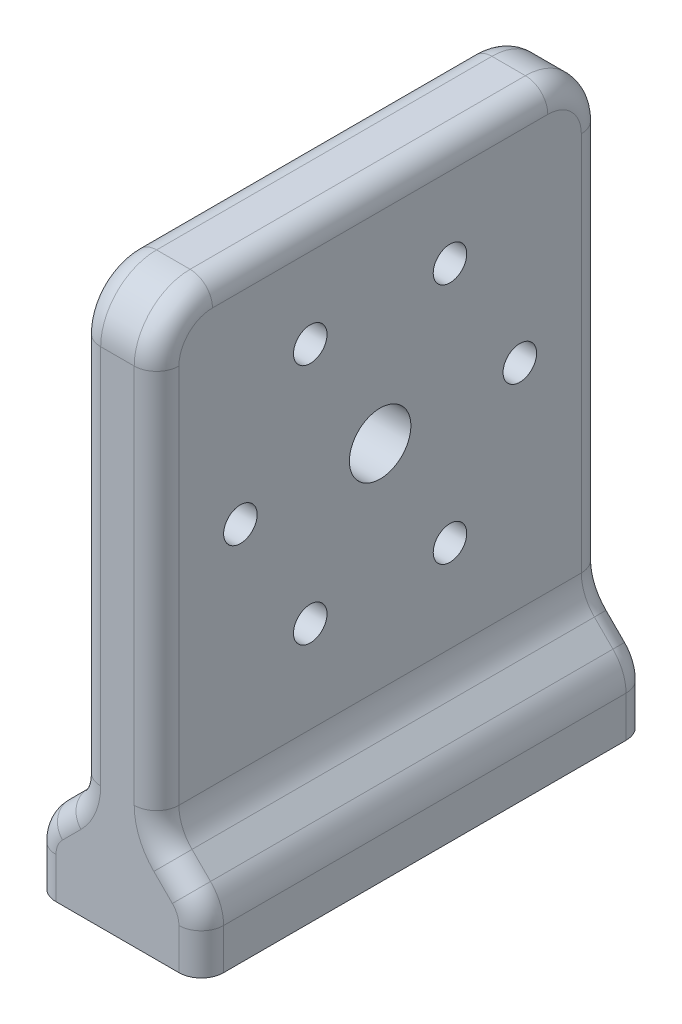
from build123d import *

# Parameters (mm, degrees)
SKETCH1_W                = 7
SKETCH1_H                = 40
BOSS_EXTRUDE1_DEPTH      = 50
BOSS_EXTRUDE2_DEPTH      = 4
BOSS_EXTRUDE2_DEPTH_BACK = 11
SKETCH3_W                = 40
SKETCH3_H                = 12.312299815
CHAMFER1_SIZE            = 7
FILLET1_R                = 4
SKETCH4_R                = 2
CUT_EXTRUDE2_DEPTH       = 10
SKETCH5_R                = 1.5
SKETCH5_R_2              = 2.75
CUT_EXTRUDE3_DEPTH       = 55.963624335
FILLET2_R                = 5
FILLET3_R                = 2


with BuildPart() as part:
    # Sketch1 → Boss-Extrude1 (new body)
    with BuildSketch(Plane(origin=(0, 0, 0), x_dir=(1, 0, 0), z_dir=(0, 1, 0))):
        Rectangle(SKETCH1_W, SKETCH1_H)
    extrude(amount=BOSS_EXTRUDE1_DEPTH)

    # Sketch3 → Boss-Extrude2 (add, two sides: drawn at the far end of the back side and taken through both)
    with BuildSketch(Plane(origin=(3.5, 0, 0), x_dir=(0, 0, -1), z_dir=(1, 0, 0)).offset(-BOSS_EXTRUDE2_DEPTH_BACK)):
        with Locations((0, 6.156149908)):
            Rectangle(SKETCH3_W, SKETCH3_H)
    extrude(amount=BOSS_EXTRUDE2_DEPTH + BOSS_EXTRUDE2_DEPTH_BACK)

    # Chamfer1
    # the kernel refuses this chamfer: 7 mm, written as the material it takes off along each edge
    with BuildSketch(Plane(origin=(-7.5, 12.312299815, 38.001780916), x_dir=(0.9996219169112968, 0.027495876610586365, 0), z_dir=(0, 0, -1))) as chamfer1_piece_1_section:
        Polygon((CHAMFER1_SIZE * 0.999621916911, CHAMFER1_SIZE * 0.0274958766106), (-CHAMFER1_SIZE * 0.0274958766106, CHAMFER1_SIZE * 0.999621916911), (0, 0), align=None)
    chamfer1_piece_1 = extrude(amount=76.003561832, mode=Mode.PRIVATE)
    chamfer1_piece_1 = split(chamfer1_piece_1, bisect_by=Plane(origin=(-3.5, 9.652025222, 0), z_dir=(-1, 0, 0)), keep=Keep.TOP, mode=Mode.PRIVATE)
    add(chamfer1_piece_1, mode=Mode.SUBTRACT)
    with BuildSketch(Plane(origin=(7.5, 12.312299815, 38.001780916), x_dir=(0.027495876610586365, -0.9996219169112968, 0), z_dir=(0, 0, -1))) as chamfer1_piece_2_section:
        Polygon((CHAMFER1_SIZE * 0.999621916911, CHAMFER1_SIZE * 0.0274958766106), (-CHAMFER1_SIZE * 0.0274958766106, CHAMFER1_SIZE * 0.999621916911), (0, 0), align=None)
    chamfer1_piece_2 = extrude(amount=76.003561832, mode=Mode.PRIVATE)
    chamfer1_piece_2 = split(chamfer1_piece_2, bisect_by=Plane(origin=(3.5, 9.652025222, 0), z_dir=(1, 0, 0)), keep=Keep.TOP, mode=Mode.PRIVATE)
    add(chamfer1_piece_2, mode=Mode.SUBTRACT)

    # Fillet1
    fillet1_edges = [part.edges().sort_by_distance(p)[0] for p in [
        (-7.5, 5.312299815, 0),
        (7.5, 5.312299815, 0),
        (-3.5, 9.312299815, 0),
        (3.5, 9.312299815, 0),
    ]]
    fillet(fillet1_edges, radius=FILLET1_R)

    # Sketch4 → Cut-Extrude2 (cut)
    with BuildSketch(Plane.XZ):
        with Locations(Location((0, 10, 0), (0, 0, 270))):
            Circle(SKETCH4_R)
        with Locations(Location((0, -10, 0), (0, 0, 90))):
            Circle(SKETCH4_R)
    extrude(amount=-CUT_EXTRUDE2_DEPTH, mode=Mode.SUBTRACT)

    # Sketch5 → Cut-Extrude3 (cut, through all)
    with BuildSketch(Plane.ZY.offset(3.5)):
        with Locations((-12.5, 30)):
            Circle(SKETCH5_R)
        with Locations((-6.25, 40.825317547)):
            Circle(SKETCH5_R)
        with Locations((6.25, 40.825317547)):
            Circle(SKETCH5_R)
        with Locations((12.5, 30)):
            Circle(SKETCH5_R)
        with Locations((6.25, 19.174682453)):
            Circle(SKETCH5_R)
        with Locations((-6.25, 19.174682453)):
            Circle(SKETCH5_R)
        with Locations((0, 30)):
            Circle(SKETCH5_R_2)
    extrude(amount=-CUT_EXTRUDE3_DEPTH, mode=Mode.SUBTRACT)

    # Fillet2
    fillet2_edges = [part.edges().sort_by_distance(p)[0] for p in [
        (0, 50, 20),
        (0, 50, -20),
    ]]
    fillet(fillet2_edges, radius=FILLET2_R)

    # Fillet3
    fillet3_edges = [part.edges().sort_by_distance(p)[0] for p in [
        (3.5, 50, 0),
        (-3.5, 50, 0),
        (-3.5, 27.984577032, -20),
        (-3.5, 27.984577032, 20),
        (-3.5, 48.535533906, 18.535533906),
        (-3.5, 48.535533906, -18.535533906),
        (3.5, 27.984577032, -20),
        (3.5, 27.984577032, 20),
        (3.5, 48.535533906, 18.535533906),
        (3.5, 48.535533906, -18.535533906),
        (-7.5, 1.827722783, -20),
        (7.5, 1.827722783, -20),
        (7.5, 1.827722783, 20),
        (-5.5, 7.312299815, 20),
        (-7.5, 1.827722783, 20),
        (5.5, 7.312299815, 20),
        (-7.19551813, 5.186179295, 20),
        (7.19551813, 5.186179295, 20),
        (5.5, 7.312299815, -20),
        (-5.5, 7.312299815, -20),
        (-7.19551813, 5.186179295, -20),
        (7.19551813, 5.186179295, -20),
        (-3.80448187, 9.438420335, 20),
        (-3.80448187, 9.438420335, -20),
        (3.80448187, 9.438420335, -20),
        (3.80448187, 9.438420335, 20),
    ]]
    fillet(fillet3_edges, radius=FILLET3_R)


solid = part.part
